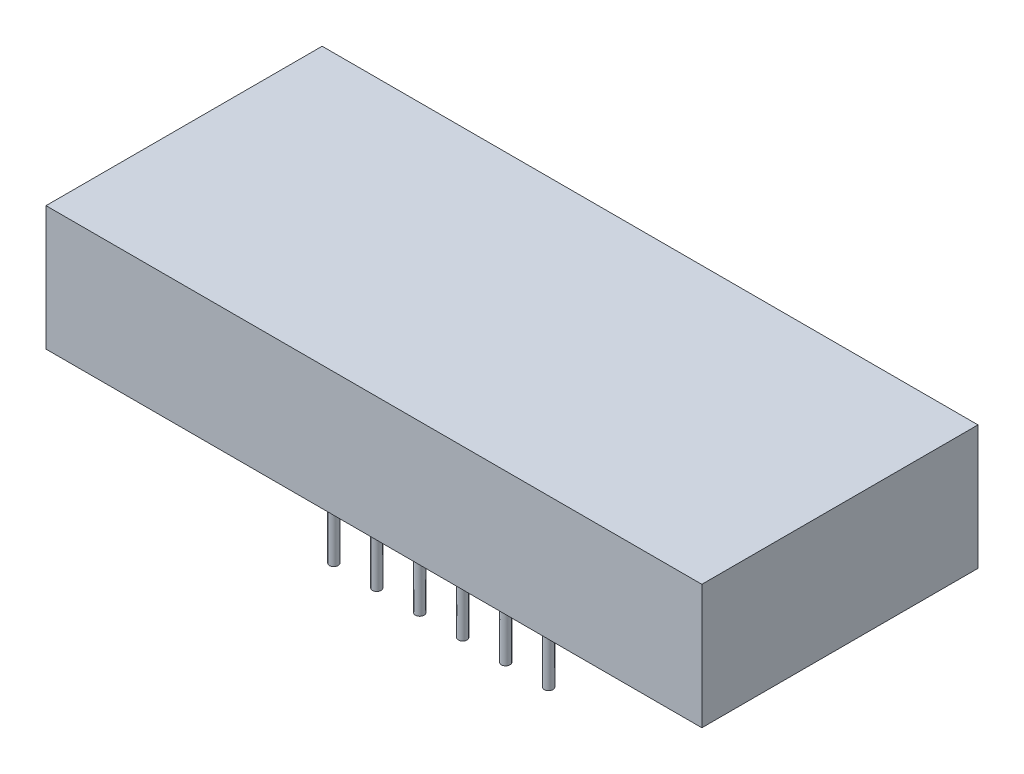
from build123d import *

# Parameters (mm, degrees)
SKETCH_1_W      = 38
SKETCH_1_H      = 16
EXTRUDE_1_DEPTH = 7.2
SKETCH_2_R      = 0.25
EXTRUDE_2_DEPTH = 6.3


with BuildPart() as part:
    # 草图1 → 拉伸1 (new body)
    with BuildSketch(Plane(origin=(0, 0, 0), x_dir=(1, 0, 0), z_dir=(0, 1, 0))):
        Rectangle(SKETCH_1_W, SKETCH_1_H)
    extrude(amount=EXTRUDE_1_DEPTH)

    # 草图2 → 拉伸2 (add)
    with BuildSketch(Plane.XZ):
        with Locations((6.224686657, 4.1)):
            Circle(SKETCH_2_R)
        with Locations((3.734811994, 4.1)):
            Circle(SKETCH_2_R)
        with Locations((1.244937331, 4.1)):
            Circle(SKETCH_2_R)
        with Locations((-1.244937331, 4.1)):
            Circle(SKETCH_2_R)
        with Locations((-3.734811994, 4.1)):
            Circle(SKETCH_2_R)
        with Locations((-6.224686657, 4.1)):
            Circle(SKETCH_2_R)
        with Locations((-6.224686657, -4.1)):
            Circle(SKETCH_2_R)
        with Locations((-3.734811994, -4.1)):
            Circle(SKETCH_2_R)
        with Locations((-1.244937331, -4.1)):
            Circle(SKETCH_2_R)
        with Locations((1.244937331, -4.1)):
            Circle(SKETCH_2_R)
        with Locations((3.734811994, -4.1)):
            Circle(SKETCH_2_R)
        with Locations((6.224686657, -4.1)):
            Circle(SKETCH_2_R)
    extrude(amount=EXTRUDE_2_DEPTH)


solid = part.part
